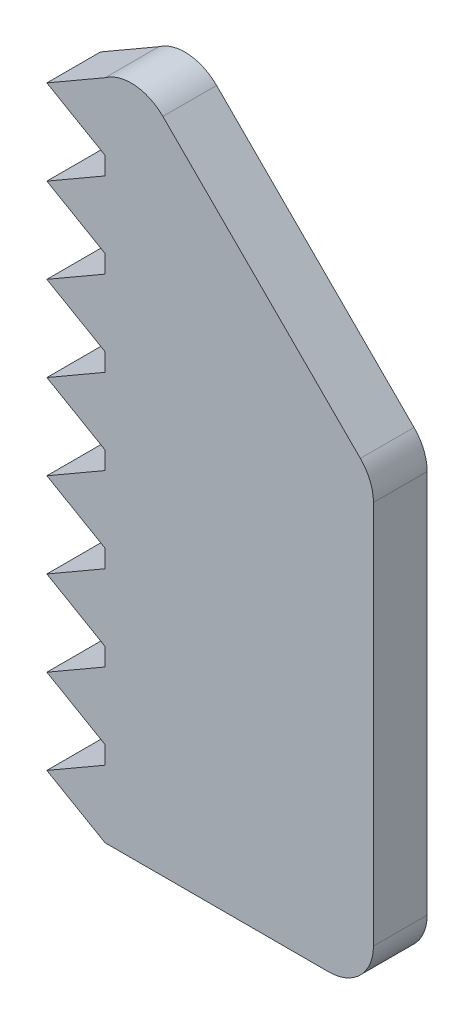
from build123d import *

# Parameters (mm, degrees)
SALIENTE_EXTRUIR1_DEPTH = 3
SALIENTE_EXTRUIR3_DEPTH = 6
REDONDEO1_R             = 5


with BuildPart() as part:
    # Croquis1 → Saliente-Extruir1 (new, symmetric)
    with BuildSketch(Plane.XY):
        Polygon((0, 20), (0, 100), (30, 70), (30, 20), align=None)
    extrude(amount=SALIENTE_EXTRUIR1_DEPTH, both=True)

    # Croquis4 → Saliente-Extruir3 (add, through all)
    with BuildSketch(Plane.XY.offset(3)):
        Polygon((0, 20), (-6.5, 23.75277675), (0, 27.505553499), align=None)
        Polygon((0, 37.011106999), (0, 29.505553499), (-6.5, 33.258330249), align=None)
        Polygon((0, 46.516660498), (0, 39.011106999), (-6.5, 42.763883749), align=None)
        Polygon((0, 56.022213998), (0, 48.516660498), (-6.5, 52.269437248), align=None)
        Polygon((0, 65.527767497), (0, 58.022213998), (-6.5, 61.774990748), align=None)
        Polygon((0, 75.033320997), (0, 67.527767497), (-6.5, 71.280544247), align=None)
        Polygon((0, 84.538874496), (0, 77.033320997), (-6.5, 80.786097747), align=None)
        Polygon((0, 94.044427996), (0, 86.538874496), (-6.5, 90.291651246), align=None)
    extrude(amount=-SALIENTE_EXTRUIR3_DEPTH)

    # Redondeo1
    # the kernel refuses this fillet: 5 mm, written as the material it takes off along each edge
    with BuildSketch(Plane(origin=(0, 100, 25.871542056), x_dir=(0, -1, 0), z_dir=(0, 0, -1))) as redondeo1_piece_1:
        with BuildLine():
            CenterArc((10.0045829, -2.933515088), REDONDEO1_R, 144.076608278, 80.923391722)
            Line((6.469048994, -6.469048994), (6.398338316, -6.539759672))
            Line((6.398338316, -6.539759672), (-0.070710678, -0.070710678))
            Line((-0.070710678, -0.070710678), (0, 0.1))
            ThreePointArc((0, 0.1), (2.977786002, 0.1), (5.874591786, 0.058670302))
            Line((5.874591786, 0.058670302), (5.955572004, 0))
        make_face()
    extrude(amount=51.743084112, mode=Mode.SUBTRACT)
    with BuildSketch(Plane(origin=(30, 20, -15.5), x_dir=(0, 1, 0), z_dir=(0, 0, 1))) as redondeo1_piece_2:
        with BuildLine():
            CenterArc((REDONDEO1_R, REDONDEO1_R), REDONDEO1_R, 180, 90)
            Line((0, REDONDEO1_R), (-REDONDEO1_R * 0.02, REDONDEO1_R))
            Line((-REDONDEO1_R * 0.02, REDONDEO1_R), (-REDONDEO1_R * 0.02, -REDONDEO1_R * 0.02))
            Line((-REDONDEO1_R * 0.02, -REDONDEO1_R * 0.02), (REDONDEO1_R, -REDONDEO1_R * 0.02))
            Line((REDONDEO1_R, -REDONDEO1_R * 0.02), (REDONDEO1_R, 0))
        make_face()
    extrude(amount=31, mode=Mode.SUBTRACT)
    with BuildSketch(Plane(origin=(30, 70, 8.17766953), x_dir=(-0.7071067811865449, 0.70710678118655, 0), z_dir=(0, 0, -1))) as redondeo1_piece_3:
        with BuildLine():
            CenterArc((REDONDEO1_R * 0.414213562373, -REDONDEO1_R), REDONDEO1_R, 90, 45)
            Line((-REDONDEO1_R * 0.292893218813, -REDONDEO1_R * 0.292893218813), (-REDONDEO1_R * 0.307035354437, -REDONDEO1_R * 0.27875108319))
            Line((-REDONDEO1_R * 0.307035354437, -REDONDEO1_R * 0.27875108319), (-REDONDEO1_R * 0.00828427124746, REDONDEO1_R * 0.02))
            Line((-REDONDEO1_R * 0.00828427124746, REDONDEO1_R * 0.02), (REDONDEO1_R * 0.414213562373, REDONDEO1_R * 0.02))
            Line((REDONDEO1_R * 0.414213562373, REDONDEO1_R * 0.02), (REDONDEO1_R * 0.414213562373, 0))
        make_face()
    extrude(amount=16.355339059, mode=Mode.SUBTRACT)


solid = part.part
